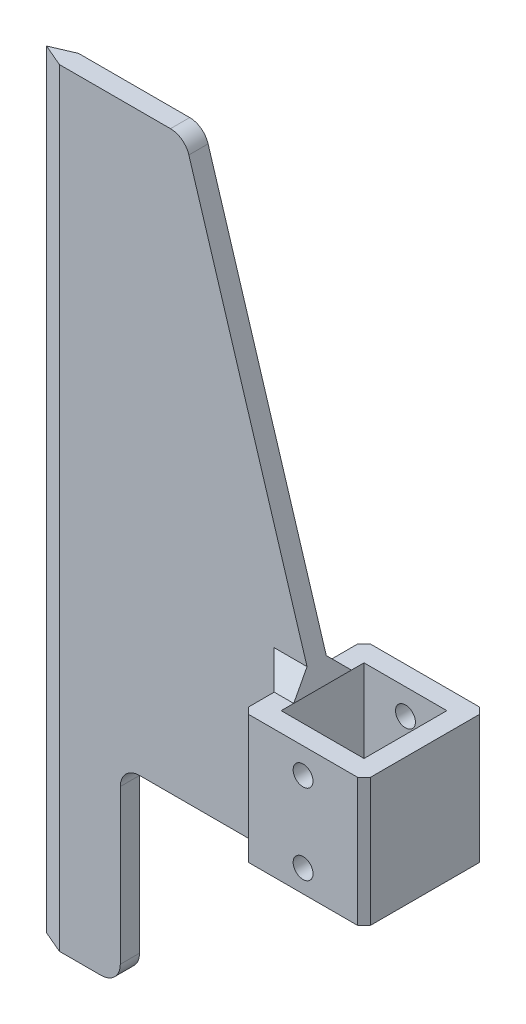
from build123d import *

# Parameters (mm, degrees)
SKETCH1_W                = 19
SKETCH1_H                = 19
SKETCH1_W_2              = 12.12
SKETCH1_H_2              = 12.12
BOSS_EXTRUDE1_DEPTH      = 20
SKETCH2_R                = 1.55
CUT_EXTRUDE1_DEPTH       = 22
SKETCH3_W                = 12.92
SKETCH3_H                = 12.92
CUT_EXTRUDE2_DEPTH       = 20
BOSS_EXTRUDE2_DEPTH      = 40
BOSS_EXTRUDE2_DEPTH_BACK = 3.04
CUT_EXTRUDE3_DEPTH       = 40
SKETCH7_W                = 13
SKETCH7_H                = 3
BOSS_EXTRUDE3_DEPTH      = 30
CUT_EXTRUDE4_DEPTH       = 129
FILLET2_R                = 3
FILLET3_R                = 3
FILLET4_R                = 3
FILLET5_SIZE             = 4.75
FILLET6_SIZE             = 3
FILLET7_SIZE             = 3
FILLET8_SIZE             = 1


with BuildPart() as part:
    # Sketch1 → Boss-Extrude1 (new body)
    with BuildSketch(Plane(origin=(0, 0, 0), x_dir=(1, 0, 0), z_dir=(0, 1, 0))):
        with Locations((9.5, 9.5)):
            Rectangle(SKETCH1_W, SKETCH1_H)
        with Locations((9.5, 9.5)):
            Rectangle(SKETCH1_W_2, SKETCH1_H_2, mode=Mode.SUBTRACT)
    extrude(amount=BOSS_EXTRUDE1_DEPTH)

    # Sketch2 → Cut-Extrude1 (cut)
    with BuildSketch(Plane.XY):
        with Locations((9.5, 16)):
            Circle(SKETCH2_R)
        with Locations((9.5, 3.5)):
            Circle(SKETCH2_R)
    extrude(amount=-CUT_EXTRUDE1_DEPTH, mode=Mode.SUBTRACT)

    # Sketch3 → Cut-Extrude2 (cut)
    with BuildSketch(Plane.XZ):
        with Locations((9.5, -9.5)):
            Rectangle(SKETCH3_W, SKETCH3_H)
    extrude(amount=-CUT_EXTRUDE2_DEPTH, mode=Mode.SUBTRACT)

    # Sketch4 → Boss-Extrude2 (add, two sides: drawn at the far end of the back side and taken through both)
    with BuildSketch(Plane.ZY.offset(-BOSS_EXTRUDE2_DEPTH_BACK)):
        Polygon((-11, 70), (-11, -4.746484506), (-8, -4.746484506), (-8, 70), (-8, 85), (-11, 85), align=None)
    extrude(amount=BOSS_EXTRUDE2_DEPTH + BOSS_EXTRUDE2_DEPTH_BACK)

    # Sketch5 → Cut-Extrude3 (cut)
    with BuildSketch(Plane.XY.offset(-8)):
        Polygon((-16.96, 85), (3.04, 20), (3.04, 85), align=None)
    extrude(amount=-CUT_EXTRUDE3_DEPTH, mode=Mode.SUBTRACT)

    # Sketch7 → Boss-Extrude3 (add)
    with BuildSketch(Plane.XZ.offset(4.746484506)):
        with Locations((-33.5, -9.5)):
            Rectangle(SKETCH7_W, SKETCH7_H)
    extrude(amount=BOSS_EXTRUDE3_DEPTH)

    # Sketch8 → Cut-Extrude4 (cut)
    with BuildSketch(Plane.XZ.offset(34.746484506)):
        Polygon((-40, -8), (-40, -9.5), (-36.5, -8), align=None)
        Polygon((-36.5, -11), (-40, -9.5), (-40, -11), align=None)
    extrude(amount=-CUT_EXTRUDE4_DEPTH, mode=Mode.SUBTRACT)

    # Fillet2
    fillet2_edges = [part.edges().sort_by_distance(p)[0] for p in [
        (-27, -4.746484506, -9.5),
    ]]
    fillet(fillet2_edges, radius=FILLET2_R)

    # Fillet3
    fillet3_edges = [part.edges().sort_by_distance(p)[0] for p in [
        (-27, -34.746484506, -9.5),
    ]]
    fillet(fillet3_edges, radius=FILLET3_R)

    # Fillet4
    fillet4_edges = [part.edges().sort_by_distance(p)[0] for p in [
        (-16.96, 85, -9.5),
    ]]
    fillet(fillet4_edges, radius=FILLET4_R)

    # Fillet5
    # the kernel refuses this chamfer: 4.75 mm, written as the material it adds along each edge
    with BuildSketch(Plane(origin=(3.04, 0, -8), x_dir=(0, -0.9996219169112968, -0.027495876610586535), z_dir=(-1, 0, 0))) as fillet5_piece_1_section:
        Polygon((FILLET5_SIZE * 0.999621916911, FILLET5_SIZE * 0.0274958766106), (-FILLET5_SIZE * 0.0274958766106, FILLET5_SIZE * 0.999621916911), (0, 0), align=None)
    fillet5_piece_1 = extrude(amount=3.04, mode=Mode.PRIVATE)
    fillet5_piece_1 = split(fillet5_piece_1, bisect_by=Plane(origin=(1.52, -4.746484506, -6.430475531), z_dir=(0, 1, 0)), keep=Keep.TOP, mode=Mode.PRIVATE)
    add(fillet5_piece_1)
    with BuildSketch(Plane(origin=(0, 0, -11), x_dir=(0, 0.02749587661058637, -0.9996219169112968), z_dir=(1, 0, 0))) as fillet5_piece_2_section:
        Polygon((FILLET5_SIZE * 0.999621916911, -FILLET5_SIZE * 0.0274958766106), (-FILLET5_SIZE * 0.0274958766106, -FILLET5_SIZE * 0.999621916911), (0, 0), align=None)
    fillet5_piece_2 = extrude(amount=3.04, mode=Mode.PRIVATE)
    fillet5_piece_2 = split(fillet5_piece_2, bisect_by=Plane(origin=(1.52, -4.746484506, -12.569524469), z_dir=(0, 1, 0)), keep=Keep.TOP, mode=Mode.PRIVATE)
    add(fillet5_piece_2)

    # Fillet6
    fillet6_edges = [part.edges().sort_by_distance(p)[0] for p in [
        (1.52, 20, -11),
        (1.52, 20, -8),
    ]]
    chamfer(fillet6_edges, length=FILLET6_SIZE)

    # Fillet7
    fillet7_edges = [part.edges().sort_by_distance(p)[0] for p in [
        (0, 9.126757747, -11),
        (0, 9.126757747, -8),
    ]]
    chamfer(fillet7_edges, length=FILLET7_SIZE)

    # Fillet8
    fillet8_edges = [part.edges().sort_by_distance(p)[0] for p in [
        (0, 10, -19),
        (19, 10, -19),
        (19, 10, 0),
        (0, 10, 0),
    ]]
    chamfer(fillet8_edges, length=FILLET8_SIZE)


solid = part.part
